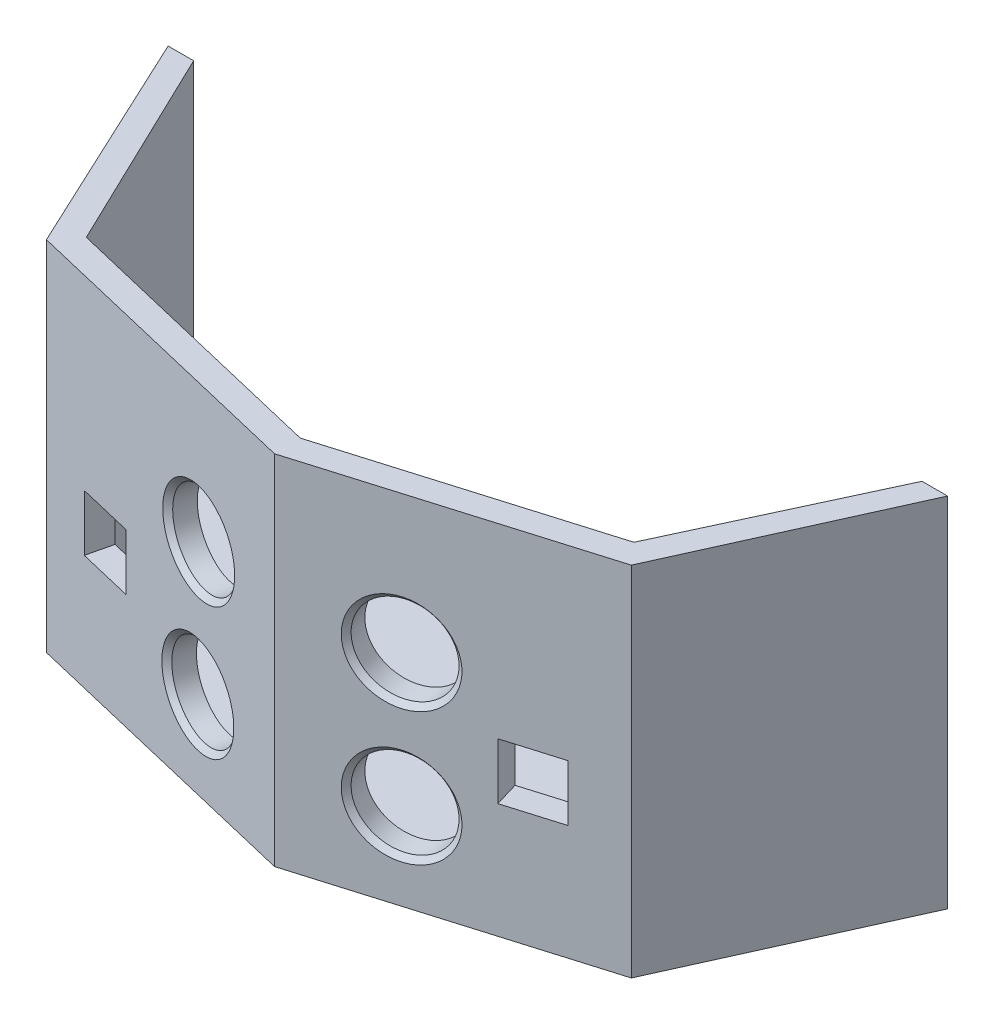
from build123d import *

# Parameters (mm, degrees)
BOSS_EXTRUDE1_DEPTH = 70
CUT_EXTRUDE1_DEPTH  = 65
SKETCH5_R           = 8.5
CUT_EXTRUDE2_DEPTH  = 10
SKETCH6_R           = 8.5
CUT_EXTRUDE3_DEPTH  = 10
CHAMFER2_SIZE       = 1
SKETCH7_W           = 11
SKETCH7_H           = 11
CUT_EXTRUDE4_DEPTH  = 10
SKETCH8_W           = 11
SKETCH8_H           = 11
CUT_EXTRUDE5_DEPTH  = 10
SKETCH9_W           = 15
SKETCH9_H           = 10
BOSS_EXTRUDE2_DEPTH = 6
FILLET1_R           = 8
FILLET2_R           = 4
SKETCH11_R          = 2.484902638
CUT_EXTRUDE7_DEPTH  = 10


with BuildPart() as part:
    # Sketch1 → Boss-Extrude1 (new body)
    with BuildSketch(Plane(origin=(0, 0, 0), x_dir=(1, 0, 0), z_dir=(0, 1, 0))):
        Polygon((-55.37403033, -102.482648945), (3.252686078, -116.449526131), (57.060212297, -100.408827863), (76.3, -57.735026919), (-76.3, -57.735026919), align=None)
    extrude(amount=BOSS_EXTRUDE1_DEPTH)

    # Sketch4 → Cut-Extrude1 (cut)
    with BuildSketch(Plane(origin=(0, 70, 0), x_dir=(1, 0, 0), z_dir=(0, 1, 0))):
        Polygon((-51.867290581, -98.178143042), (3.108154981, -111.275163368), (53.44146669, -96.270172009), (71.3, -57.735026919), (-71.3, -57.735026919), align=None)
    extrude(amount=-CUT_EXTRUDE1_DEPTH, mode=Mode.SUBTRACT)

    # Sketch5 → Cut-Extrude2 (cut)
    with BuildSketch(Plane(origin=(-26.077584107, 0, 109.462058529), x_dir=(0.9727757912880333, 0, 0.23174826835154788), z_dir=(-0.23174826835154788, 0, 0.9727757912880333))):
        with Locations((10.114141871, 42.998978407)):
            Circle(SKETCH5_R)
        with Locations((9.883660258, 17)):
            Circle(SKETCH5_R)
    extrude(amount=-CUT_EXTRUDE2_DEPTH, mode=Mode.SUBTRACT)

    # Sketch6 → Cut-Extrude3 (cut)
    with BuildSketch(Plane(origin=(32.147178959, 0, 107.83571549), x_dir=(0.9583226816177197, 0, -0.28568800796852273), z_dir=(0.2856880079685227, 0, 0.9583226816177196))):
        with Locations((-10.151110305, 17)):
            Circle(SKETCH6_R)
        with Locations((-10.151110305, 43)):
            Circle(SKETCH6_R)
    extrude(amount=-CUT_EXTRUDE3_DEPTH, mode=Mode.SUBTRACT)

    # Chamfer2
    chamfer2_edges = [part.edges().sort_by_distance(p)[0] for p in [
        (-24.507385971, 42.998978407, 109.836133113),
        (-24.731592905, 17, 109.782719398),
        (14.273396917, 17, 113.164114039),
        (14.273396917, 43, 113.164114039),
    ]]
    chamfer(chamfer2_edges, length=CHAMFER2_SIZE)

    # Sketch7 → Cut-Extrude4 (cut)
    with BuildSketch(Plane(origin=(-26.077584107, 0, 109.462058529), x_dir=(0.9727757912880333, 0, 0.23174826835154788), z_dir=(-0.23174826835154788, 0, 0.9727757912880333))):
        with Locations((-14.616339742, 28)):
            Rectangle(SKETCH7_W, SKETCH7_H)
    extrude(amount=-CUT_EXTRUDE4_DEPTH, mode=Mode.SUBTRACT)

    # Sketch8 → Cut-Extrude5 (cut)
    with BuildSketch(Plane(origin=(32.147178959, 0, 107.83571549), x_dir=(0.9583226816177197, 0, -0.28568800796852273), z_dir=(0.2856880079685227, 0, 0.9583226816177196))):
        with Locations((10.496497648, 28)):
            Rectangle(SKETCH8_W, SKETCH8_H)
    extrude(amount=-CUT_EXTRUDE5_DEPTH, mode=Mode.SUBTRACT)

    # Sketch9 → Boss-Extrude2 (add)
    with BuildSketch(Plane(origin=(0, 0, 57.735026919), x_dir=(-1, 0, 0), z_dir=(0, 0, -1))):
        with Locations((0, 10)):
            Rectangle(SKETCH9_W, SKETCH9_H)
    extrude(amount=-BOSS_EXTRUDE2_DEPTH)

    # Fillet1
    # the kernel refuses this fillet: 8 mm, written as the material it takes off along each edge
    with BuildSketch(Plane(origin=(-7.5, 15, 37.735026919), x_dir=(0, -1, 0), z_dir=(0, 0, 1))) as fillet1_piece_1:
        with BuildLine():
            CenterArc((FILLET1_R, FILLET1_R), FILLET1_R, 180, 90)
            Line((0, FILLET1_R), (0, 0))
            Line((0, 0), (FILLET1_R, 0))
        make_face()
    extrude(amount=46, mode=Mode.SUBTRACT)
    with BuildSketch(Plane(origin=(7.5, 15, 37.735026919), x_dir=(0, -1, 0), z_dir=(0, 0, 1))) as fillet1_piece_2:
        with BuildLine():
            CenterArc((FILLET1_R, -FILLET1_R), FILLET1_R, 90, 90)
            Line((0, -FILLET1_R), (0, 0))
            Line((0, 0), (FILLET1_R, 0))
        make_face()
    extrude(amount=46, mode=Mode.SUBTRACT)

    # Fillet2
    # the kernel refuses this fillet: 4 mm, written as the material it adds along each edge
    with BuildSketch(Plane(origin=(-7.5, 5, 57.735026919), x_dir=(-1, 0, 0), z_dir=(0, 0, 1))) as fillet2_piece_1:
        with BuildLine():
            CenterArc((3.832159566, -4), FILLET2_R, 90, 80.405931773)
            Line((-0.111893623, -3.333333333), (-0.506298941, -3.266666667))
            ThreePointArc((-0.506298941, -3.266666667), (-0.4, -2), (-0.4, 0))
            Line((-0.4, 0), (0, 0.4))
            Line((0, 0.4), (3.832159566, 0.4))
            Line((3.832159566, 0.4), (3.832159566, 0))
        make_face()
    extrude(amount=6)
    with BuildSketch(Plane(origin=(7.5, 5, 57.735026919), x_dir=(1, 0, 0), z_dir=(0, 0, 1))) as fillet2_piece_2:
        with BuildLine():
            CenterArc((3.832159566, 4), FILLET2_R, 189.594068227, 80.405931773)
            Line((-0.111893623, 3.333333333), (-0.506298941, 3.266666667))
            ThreePointArc((-0.506298941, 3.266666667), (-0.4, 2), (-0.4, 0))
            Line((-0.4, 0), (0, -0.4))
            Line((0, -0.4), (3.832159566, -0.4))
            Line((3.832159566, -0.4), (3.832159566, 0))
        make_face()
    extrude(amount=6)

    # Sketch11 → Cut-Extrude7 (cut)
    with BuildSketch(Plane(origin=(0, 0, 57.735026919), x_dir=(-1, 0, 0), z_dir=(0, 0, -1))):
        with Locations((0, 9)):
            Circle(SKETCH11_R)
    extrude(amount=-CUT_EXTRUDE7_DEPTH, mode=Mode.SUBTRACT)


solid = part.part
